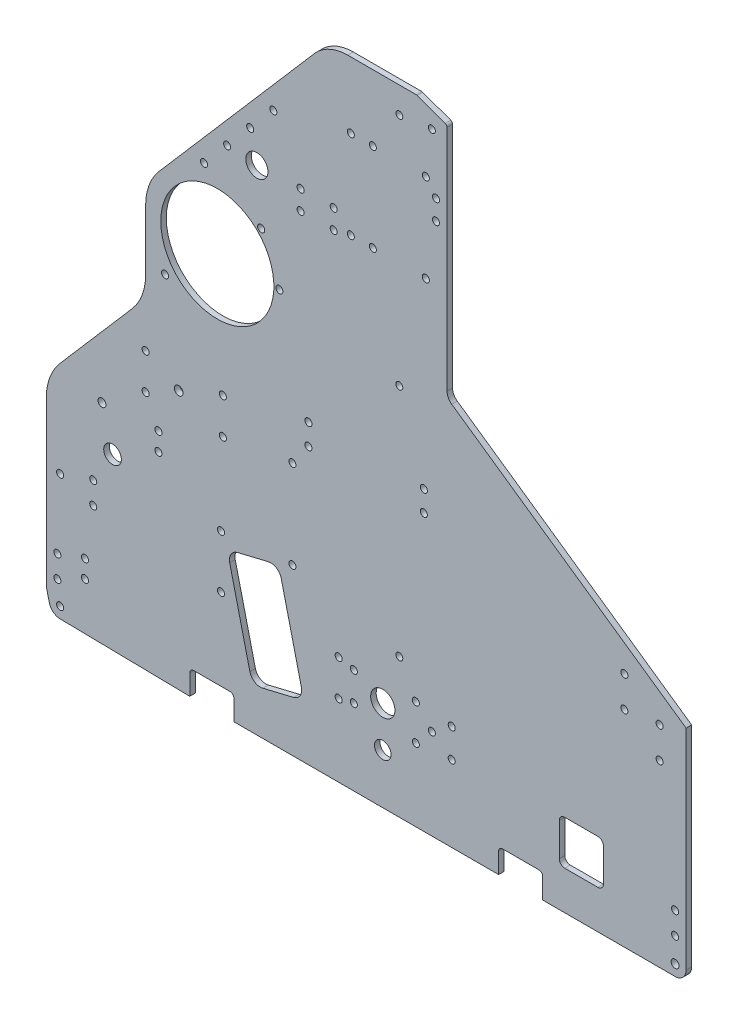
from build123d import *

# Parameters (mm, degrees)
SKETCH1_R           = 2.032
SKETCH1_R_2         = 5.08
SKETCH1_R_3         = 2.54
SKETCH1_R_4         = 2
BOSS_EXTRUDE1_DEPTH = 3.175
FILLET1_R           = 2.286
FILLET2_R           = 6.35
SKETCH2_R           = 2.032
CUT_EXTRUDE1_DEPTH  = 505.524983177
FILLET3_R           = 1.5875
SKETCH3_R           = 2.032
SKETCH3_R_2         = 2.286
CUT_EXTRUDE2_DEPTH  = 505.524983177
SKETCH4_R           = 2.032
SKETCH4_R_2         = 6.985
SKETCH4_R_3         = 4.7625
CUT_EXTRUDE3_DEPTH  = 505.524983177
SKETCH5_R           = 32.54375
SKETCH5_R_2         = 2.286000001
CUT_EXTRUDE5_DEPTH  = 505.524983177
FILLET4_R           = 31.75
CUT_EXTRUDE6_DEPTH  = 505.524983177
FILLET5_R           = 25.4
SKETCH8_R           = 2.031999999
SKETCH8_R_2         = 2.032000002
SKETCH8_R_3         = 2.031999998
CUT_EXTRUDE7_DEPTH  = 505.524983177
SKETCH10_R          = 2.032
CUT_EXTRUDE8_DEPTH  = 505.524983177
FILLET6_R           = 6.35
SKETCH11_RX         = 2.032
SKETCH11_RY         = 2.031999502
CUT_EXTRUDE9_DEPTH  = 505.524983177
SKETCH12_R          = 2.032
CUT_EXTRUDE10_DEPTH = 505.524983319
SKETCH14_R          = 6.375981846
CUT_EXTRUDE11_DEPTH = 505.524983319


with BuildPart() as part:
    # Sketch1 → Boss-Extrude1 (new body)
    with BuildSketch(Plane.XY):
        with BuildLine():
            Line((7.829508682, -19.049081656), (82.55, -20.32))
            Line((82.55, -20.32), (82.55, -6.35))
            Line((82.55, -6.35), (107.95, -6.35))
            Line((107.95, -6.35), (107.95, -20.32))
            Line((107.95, -20.32), (260.35, -20.32))
            Line((260.35, -20.32), (260.35, -6.35))
            Line((260.35, -6.35), (285.75, -6.35))
            Line((285.75, -6.35), (285.75, -20.32))
            Line((285.75, -20.32), (368.3, -20.32))
            Line((368.3, -20.32), (368.3, 106.68))
            Line((368.3, 106.68), (230.66375, 202.565))
            Line((230.66375, 202.565), (230.66375, 338.455))
            Line((230.66375, 338.455), (213.19998, 344.805))
            Line((213.19998, 344.805), (203.2, 344.805))
            Line((203.2, 344.805), (161.925, 344.805))
            Line((161.925, 344.805), (52.720122664, 218.469945827))
            ThreePointArc((52.720122664, 218.469945827), (52.803835479, 218.142145922), (52.832, 217.805))
            ThreePointArc((52.832, 217.805), (52.095493096, 216.239521914), (50.419872403, 215.808871996))
            Line((50.419872403, 215.808871996), (0, 157.48))
            Line((0, 157.48), (0, 0))
            Line((0, 0), (0, -6.35))
            ThreePointArc((0, -6.35), (0.047577015, -7.125863724), (0.189595124, -7.890101219))
            Line((0.189595124, -7.890101219), (1.777095124, -14.240101219))
            ThreePointArc((1.777095124, -14.240101219), (3.987212552, -17.671692778), (7.829508682, -19.049081656))
        make_face()
        with Locations((7.9375, -12.7)):
            Circle(SKETCH1_R, mode=Mode.SUBTRACT)
        with Locations((6.35, 0)):
            Circle(SKETCH1_R, mode=Mode.SUBTRACT)
        with Locations((6.35, 12.7)):
            Circle(SKETCH1_R, mode=Mode.SUBTRACT)
        with Locations((38.1, 78.105)):
            Circle(SKETCH1_R_2, mode=Mode.SUBTRACT)
        with Locations((57.15, 118.58625)):
            Circle(SKETCH1_R, mode=Mode.SUBTRACT)
        with Locations((57.15, 139.22375)):
            Circle(SKETCH1_R, mode=Mode.SUBTRACT)
        with Locations((76.2, 128.905)):
            Circle(SKETCH1_R_3, mode=Mode.SUBTRACT)
        with Locations((101.6, 118.58625)):
            Circle(SKETCH1_R, mode=Mode.SUBTRACT)
        with Locations((101.6, 139.22375)):
            Circle(SKETCH1_R, mode=Mode.SUBTRACT)
        with Locations((203.2, 59.805)):
            Circle(SKETCH1_R_4, mode=Mode.SUBTRACT)
        with Locations((361.95, 0)):
            Circle(SKETCH1_R, mode=Mode.SUBTRACT)
        with Locations((361.95, 12.7)):
            Circle(SKETCH1_R, mode=Mode.SUBTRACT)
        with Locations((353.06, 82.955052336)):
            Circle(SKETCH1_R, mode=Mode.SUBTRACT)
        with Locations((332.74, 98.195052336)):
            Circle(SKETCH1_R, mode=Mode.SUBTRACT)
        with Locations((332.74, 115.975052336)):
            Circle(SKETCH1_R, mode=Mode.SUBTRACT)
        with Locations((353.06, 100.735052336)):
            Circle(SKETCH1_R, mode=Mode.SUBTRACT)
        with Locations((68.326, 182.923674932)):
            Circle(SKETCH1_R, mode=Mode.SUBTRACT)
        with Locations((76.2, 217.805)):
            Circle(SKETCH1_R, mode=Mode.SUBTRACT)
        with Locations((90.779500502, 249.682)):
            Circle(SKETCH1_R, mode=Mode.SUBTRACT)
        with Locations((104.067838673, 265.054783374)):
            Circle(SKETCH1_R, mode=Mode.SUBTRACT)
        with Locations((117.356176844, 280.427566748)):
            Circle(SKETCH1_R, mode=Mode.SUBTRACT)
        with Locations((130.644515014, 295.800350122)):
            Circle(SKETCH1_R, mode=Mode.SUBTRACT)
        with Locations((203.2, 194.805)):
            Circle(SKETCH1_R_4, mode=Mode.SUBTRACT)
        with Locations((224.31375, 287.401)):
            Circle(SKETCH1_R, mode=Mode.SUBTRACT)
        with Locations((224.31375, 298.831)):
            Circle(SKETCH1_R, mode=Mode.SUBTRACT)
        with Locations((203.2, 329.805)):
            Circle(SKETCH1_R_4, mode=Mode.SUBTRACT)
        with Locations((221.931865, 332.105)):
            Circle(SKETCH1_R_4, mode=Mode.SUBTRACT)
    extrude(amount=BOSS_EXTRUDE1_DEPTH)

    # Fillet1
    fillet1_edges = [part.edges().sort_by_distance(p)[0] for p in [
        (285.75, -6.35, 1.5875),
        (107.95, -6.35, 1.5875),
        (260.35, -6.35, 1.5875),
        (82.55, -6.35, 1.5875),
    ]]
    fillet(fillet1_edges, radius=FILLET1_R)

    # Fillet2
    fillet2_edges = [part.edges().sort_by_distance(p)[0] for p in [
        (230.66375, 202.565, 1.5875),
    ]]
    fillet(fillet2_edges, radius=FILLET2_R)

    # Sketch2 → Cut-Extrude1 (cut, through all)
    with BuildSketch(Plane(origin=(0, 0, 0), x_dir=(-1, 0, 0), z_dir=(0, 0, -1))):
        with Locations((-100.552770272, 71.086035298)):
            Circle(SKETCH2_R)
        with Locations((-100.552770272, 40.606035298)):
            Circle(SKETCH2_R)
        with Locations((-22.225, 18.202541089)):
            Circle(SKETCH2_R)
        with Locations((-22.225, 8.042541089)):
            Circle(SKETCH2_R)
    extrude(amount=-CUT_EXTRUDE1_DEPTH, mode=Mode.SUBTRACT)

    # Fillet3
    fillet3_edges = [part.edges().sort_by_distance(p)[0] for p in [
        (230.66375, 338.455, 1.5875),
        (213.19998, 344.805, 1.5875),
    ]]
    fillet(fillet3_edges, radius=FILLET3_R)

    # Sketch3 → Cut-Extrude2 (cut, through all)
    with BuildSketch(Plane.XY.offset(3.175)):
        with BuildLine():
            Line((127.789350211, 69.359774106), (110.090750339, 65.117184968))
            ThreePointArc((110.090750339, 65.117184968), (106.287939856, 62.356288953), (105.55119507, 57.715047577))
            Line((105.55119507, 57.715047577), (117.160037875, 9.287010566))
            ThreePointArc((117.160037875, 9.287010566), (119.92093389, 5.484200083), (124.562175266, 4.747455297))
            Line((124.562175266, 4.747455297), (142.260775137, 8.990044434))
            ThreePointArc((142.260775137, 8.990044434), (146.063585621, 11.75094045), (146.800330407, 16.392181825))
            Line((146.800330407, 16.392181825), (135.191487602, 64.820218836))
            ThreePointArc((135.191487602, 64.820218836), (132.430591586, 68.62302932), (127.789350211, 69.359774106))
        make_face()
        with Locations((26.987500002, 46.953113935)):
            Circle(SKETCH3_R)
        with Locations((26.987500002, 59.653113935)):
            Circle(SKETCH3_R)
        with Locations((7.937500002, 53.303113935)):
            Circle(SKETCH3_R)
        with Locations((32.030600738, 100.810868776)):
            Circle(SKETCH3_R_2)
        with Locations((64.525942114, 102.94048958)):
            Circle(SKETCH3_R)
        with Locations((64.525942114, 92.525786339)):
            Circle(SKETCH3_R)
        with Locations((134.14375, 208.228121768)):
            Circle(SKETCH3_R)
        with Locations((123.681970341, 233.485092108)):
            Circle(SKETCH3_R)
    extrude(amount=-CUT_EXTRUDE2_DEPTH, mode=Mode.SUBTRACT)

    # Sketch4 → Cut-Extrude3 (cut, through all)
    with BuildSketch(Plane.XY.offset(3.175)):
        with Locations((168.275, 42.06875)):
            Circle(SKETCH4_R)
        with Locations((212.725, 42.06875)):
            Circle(SKETCH4_R)
        with Locations((212.725, 21.43125)):
            Circle(SKETCH4_R)
        with Locations((168.275, 21.43125)):
            Circle(SKETCH4_R)
        with Locations((193.675, 31.75)):
            Circle(SKETCH4_R_2)
        with Locations((177.00498, 40.0431)):
            Circle(SKETCH4_R)
        with Locations((177.00498, 23.4569)):
            Circle(SKETCH4_R)
        with Locations((193.675, 8.466666658)):
            Circle(SKETCH4_R_3)
        with Locations((221.931865, 31.75)):
            Circle(SKETCH4_R)
        with Locations((233.36123, 23.4569)):
            Circle(SKETCH4_R)
        with Locations((233.36123, 40.0431)):
            Circle(SKETCH4_R)
    extrude(amount=-CUT_EXTRUDE3_DEPTH, mode=Mode.SUBTRACT)

    # Sketch5 → Cut-Extrude5 (cut, through all)
    with BuildSketch(Plane(origin=(0, 0, 0), x_dir=(-1, 0, 0), z_dir=(0, 0, -1))):
        Polygon((0, 157.48), (-57.15, 223.594705882), (-57.15, 165.333696112), (0, 99.218990229), align=None)
        with Locations((-98.425, 208.228121768)):
            Circle(SKETCH5_R)
        with Locations((-361.95, -13.97)):
            Circle(SKETCH5_R_2)
    extrude(amount=-CUT_EXTRUDE5_DEPTH, mode=Mode.SUBTRACT)

    # Fillet4
    fillet4_edges = [part.edges().sort_by_distance(p)[0] for p in [
        (0, 99.218990229, 1.5875),
        (57.15, 165.333696112, 1.5875),
        (57.15, 223.594705882, 1.5875),
    ]]
    fillet(fillet4_edges, radius=FILLET4_R)

    # Sketch6 → Cut-Extrude6 (cut, through all)
    with BuildSketch(Plane.XY.offset(3.175)):
        with BuildLine():
            Line((298.45, 27.305), (317.5, 27.305))
            ThreePointArc((317.5, 27.305), (319.74506403, 26.37506403), (320.675, 24.13))
            Line((320.675, 24.13), (320.675, 5.08))
            ThreePointArc((320.675, 5.08), (319.74506403, 2.83493597), (317.5, 1.905))
            Line((317.5, 1.905), (298.45, 1.905))
            ThreePointArc((298.45, 1.905), (296.20493597, 2.83493597), (295.275, 5.08))
            Line((295.275, 5.08), (295.275, 24.13))
            ThreePointArc((295.275, 24.13), (296.20493597, 26.37506403), (298.45, 27.305))
        make_face()
    extrude(amount=-CUT_EXTRUDE6_DEPTH, mode=Mode.SUBTRACT)

    # Fillet5
    fillet5_edges = [part.edges().sort_by_distance(p)[0] for p in [
        (161.925, 344.805, 1.5875),
    ]]
    fillet(fillet5_edges, radius=FILLET5_R)

    # Sketch8 → Cut-Extrude7 (cut, through all)
    with BuildSketch(Plane(origin=(0, 0, 0), x_dir=(-1, 0, 0), z_dir=(0, 0, -1))):
        with Locations((-187.96, 306.70500001)):
            Circle(SKETCH8_R)
        with Locations((-187.96, 255.904999997)):
            Circle(SKETCH8_R_2)
        with Locations((-218.44, 306.70500001)):
            Circle(SKETCH8_R_3)
        with Locations((-175.26, 306.70500001)):
            Circle(SKETCH8_R)
        with Locations((-175.26, 255.904999997)):
            Circle(SKETCH8_R_2)
        with Locations((-218.44, 255.904999997)):
            Circle(SKETCH8_R_2)
    extrude(amount=-CUT_EXTRUDE7_DEPTH, mode=Mode.SUBTRACT)

    # Sketch10 → Cut-Extrude8 (cut, through all)
    with BuildSketch(Plane.XY.offset(3.175)):
        with Locations((141.642478919, 74.684371768)):
            Circle(SKETCH10_R)
        with Locations((141.642478919, 125.484371768)):
            Circle(SKETCH10_R)
    extrude(amount=-CUT_EXTRUDE8_DEPTH, mode=Mode.SUBTRACT)

    # Fillet6
    fillet6_edges = [part.edges().sort_by_distance(p)[0] for p in [
        (368.3, -20.32, 1.5875),
    ]]
    fillet(fillet6_edges, radius=FILLET6_R)

    # Sketch11 → Cut-Extrude9 (cut, through all)
    with BuildSketch(Plane.XY.offset(3.175)):
        with Locations(Location((150.881424454, 138.43), (0, 0, 90))):
            Ellipse(SKETCH11_RX, SKETCH11_RY)
        with Locations(Location((150.881424454, 150.495), (0, 0, 90))):
            Ellipse(SKETCH11_RX, SKETCH11_RY)
        with Locations(Location((217.30240818, 150.495), (0, 0, 90))):
            Ellipse(SKETCH11_RX, SKETCH11_RY)
        with Locations(Location((217.30240818, 138.43), (0, 0, 90))):
            Ellipse(SKETCH11_RX, SKETCH11_RY)
    extrude(amount=-CUT_EXTRUDE9_DEPTH, mode=Mode.SUBTRACT)

    # Sketch12 → Cut-Extrude10 (cut, through all)
    with BuildSketch(Plane(origin=(0, 0, 0), x_dir=(-1, 0, 0), z_dir=(0, 0, -1))):
        with Locations((-165.4175, 264.63498)):
            Circle(SKETCH12_R)
        with Locations((-165.4175, 253.52248)):
            Circle(SKETCH12_R)
        with Locations((-146.3675, 253.52248)):
            Circle(SKETCH12_R)
        with Locations((-146.3675, 264.63498)):
            Circle(SKETCH12_R)
    extrude(amount=-CUT_EXTRUDE10_DEPTH, mode=Mode.SUBTRACT)

    # Sketch14 → Cut-Extrude11 (cut, through all)
    with BuildSketch(Plane(origin=(0, 0, 0), x_dir=(-1, 0, 0), z_dir=(0, 0, -1))):
        with Locations((-121.184716432, 263.688494682)):
            Circle(SKETCH14_R)
    extrude(amount=-CUT_EXTRUDE11_DEPTH, mode=Mode.SUBTRACT)


solid = part.part
